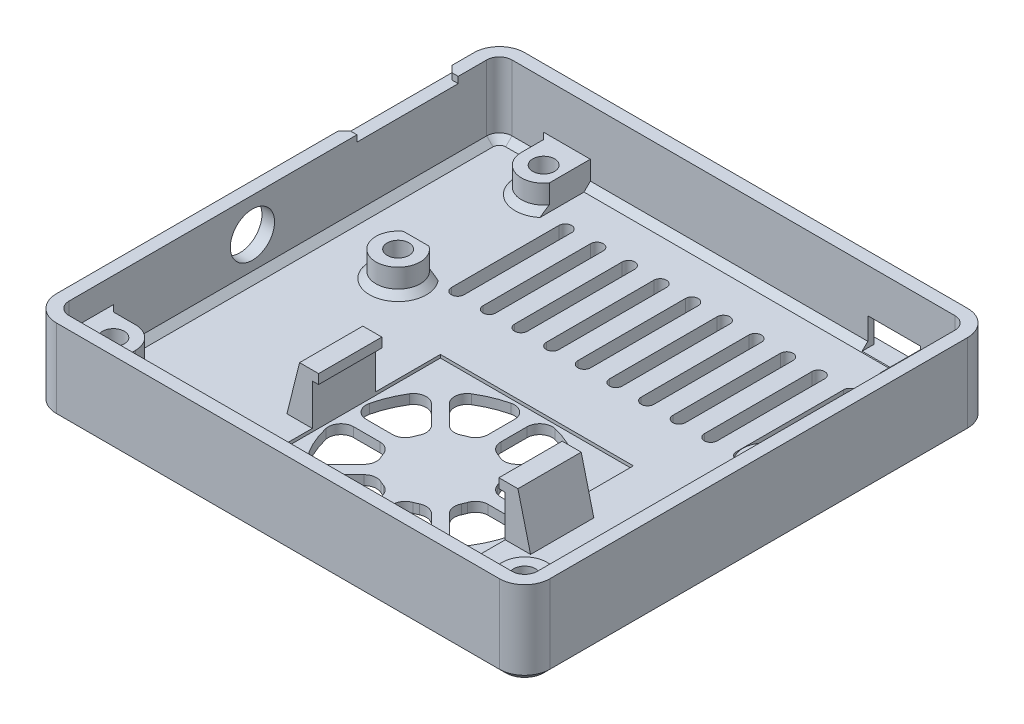
from build123d import *

# Parameters (mm, degrees)
BOSS_EXTRUDE1_DEPTH                               = 13.4
BOSS_EXTRUDE2_DEPTH                               = 2
BOSS_EXTRUDE3_DEPTH                               = 4
CSK_FOR_4_FLAT_HEAD_SOCKET_CAP_SCREW1_D           = 3.4544
CSK_FOR_4_FLAT_HEAD_SOCKET_CAP_SCREW1_CSINK_D     = 6.7237102
CSK_FOR_4_FLAT_HEAD_SOCKET_CAP_SCREW1_CSINK_ANGLE = 82
CUT_EXTRUDE1_REACH                                = 108.647
SKETCH7_W                                         = 8.3
SKETCH7_H                                         = 4.4
BOSS_EXTRUDE4_DEPTH                               = 7.4
CSK_FOR_4_FLAT_HEAD_SOCKET_CAP_SCREW2_D           = 3.4544
CSK_FOR_4_FLAT_HEAD_SOCKET_CAP_SCREW2_CSINK_D     = 6.7237102
CSK_FOR_4_FLAT_HEAD_SOCKET_CAP_SCREW2_CSINK_ANGLE = 82
CHAMFER1_SIZE                                     = 1
CHAMFER2_SIZE                                     = 1
CHAMFER3_SIZE                                     = 1
CHAMFER4_SIZE                                     = 1
CUT_EXTRUDE2_REACH                                = 97.86
SKETCH13_W                                        = 30.5
SKETCH13_H                                        = 30.5
CUT_EXTRUDE3_DEPTH                                = 0.5
SKETCH14_W                                        = 2
SKETCH14_H                                        = 10
BOSS_EXTRUDE5_DEPTH                               = 8
SKETCH15_W                                        = 10
SKETCH15_H                                        = 1.5
BOSS_EXTRUDE6_DEPTH                               = 1
SKETCH16_W                                        = 10
SKETCH16_H                                        = 1.5
BOSS_EXTRUDE7_DEPTH                               = 1
CHAMFER5_SIZE                                     = 2
CHAMFER5_SIZE_2                                   = 8.021561867
CUT_EXTRUDE4_DEPTH                                = 96.661387058
SKETCH18_R                                        = 3.5
CUT_EXTRUDE5_DEPTH                                = 97.161962556
CUT_EXTRUDE6_REACH                                = 99.75
SKETCH19_W                                        = 16
SKETCH19_H                                        = 1
CHAMFER6_SIZE                                     = 1


with BuildPart() as part:
    # Sketch2 → Boss-Extrude1 (new body)
    with BuildSketch(Plane(origin=(0, 0, 0), x_dir=(1, 0, 0), z_dir=(0, 1, 0))):
        with BuildLine():
            Line((-75.616981764, 12.627854819), (-75.616981764, -53.372145181))
            ThreePointArc((-75.616981764, -53.372145181), (-74.445408889, -56.200572306), (-71.616981764, -57.372145181))
            Line((-71.616981764, -57.372145181), (-1.616981764, -57.372145181))
            ThreePointArc((-1.616981764, -57.372145181), (1.211445361, -56.200572306), (2.383018236, -53.372145181))
            Line((2.383018236, -53.372145181), (2.383018236, 12.627854819))
            ThreePointArc((2.383018236, 12.627854819), (1.211445361, 15.456281944), (-1.616981764, 16.627854819))
            Line((-1.616981764, 16.627854819), (-71.616981764, 16.627854819))
            ThreePointArc((-71.616981764, 16.627854819), (-74.445408889, 15.456281944), (-75.616981764, 12.627854819))
        make_face()
        with BuildLine():
            Line((-73.616981764, 12.627854819), (-73.616981764, -53.372145181))
            ThreePointArc((-73.616981764, -53.372145181), (-73.031195326, -54.786358744), (-71.616981764, -55.372145181))
            Line((-71.616981764, -55.372145181), (-1.616981764, -55.372145181))
            ThreePointArc((-1.616981764, -55.372145181), (-0.202768202, -54.786358744), (0.383018236, -53.372145181))
            Line((0.383018236, -53.372145181), (0.383018236, 12.627854819))
            ThreePointArc((0.383018236, 12.627854819), (-0.202768202, 14.042068381), (-1.616981764, 14.627854819))
            Line((-1.616981764, 14.627854819), (-71.616981764, 14.627854819))
            ThreePointArc((-71.616981764, 14.627854819), (-73.031195326, 14.042068381), (-73.616981764, 12.627854819))
        make_face(mode=Mode.SUBTRACT)
    extrude(amount=BOSS_EXTRUDE1_DEPTH)

    # Sketch2<3> → Boss-Extrude2 (add)
    with BuildSketch(Plane(origin=(0, 0, 0), x_dir=(1, 0, 0), z_dir=(0, 1, 0))):
        with BuildLine():
            Line((-71.616981764, 14.627854819), (-1.616981764, 14.627854819))
            ThreePointArc((-1.616981764, 14.627854819), (-0.202768202, 14.042068381), (0.383018236, 12.627854819))
            Line((0.383018236, 12.627854819), (0.383018236, -53.372145181))
            ThreePointArc((0.383018236, -53.372145181), (-0.202768202, -54.786358744), (-1.616981764, -55.372145181))
            Line((-1.616981764, -55.372145181), (-71.616981764, -55.372145181))
            ThreePointArc((-71.616981764, -55.372145181), (-73.031195326, -54.786358744), (-73.616981764, -53.372145181))
            Line((-73.616981764, -53.372145181), (-73.616981764, 12.627854819))
            ThreePointArc((-73.616981764, 12.627854819), (-73.031195326, 14.042068381), (-71.616981764, 14.627854819))
        make_face()
    extrude(amount=BOSS_EXTRUDE2_DEPTH)

    # Sketch4 → Boss-Extrude3 (add)
    with BuildSketch(Plane(origin=(0, 2, 0), x_dir=(1, 0, 0), z_dir=(0, 1, 0))):
        with BuildLine():
            Line((-59.234341769, 14.627854819), (-59.234341769, 8.142814098))
            ThreePointArc((-59.234341769, 8.142814098), (-63.156395065, 6.785756677), (-65.616981764, 10.127854819))
            Line((-65.616981764, 10.127854819), (-65.616981764, 14.627854819))
            Line((-65.616981764, 14.627854819), (-59.234341769, 14.627854819))
        make_face()
        with BuildLine():
            Line((-4.116981764, 6.627854819), (0.383018236, 6.627854819))
            Line((0.383018236, 6.627854819), (0.383018236, 12.627854819))
            ThreePointArc((0.383018236, 12.627854819), (-0.202768202, 14.042068381), (-1.616981764, 14.627854819))
            Line((-1.616981764, 14.627854819), (-7.082532008, 14.627854819))
            Line((-7.082532008, 14.627854819), (-7.082532008, 8.268954136))
            ThreePointArc((-7.082532008, 8.268954136), (-5.811656897, 7.065490341), (-4.116981764, 6.627854819))
        make_face()
        with BuildLine():
            Line((-4.116981764, -9.372145181), (0.383018236, -9.372145181))
            Line((0.383018236, -9.372145181), (0.383018236, -16.372145181))
            Line((0.383018236, -16.372145181), (-4.116981764, -16.372145181))
            ThreePointArc((-4.116981764, -16.372145181), (-7.616981764, -12.872145181), (-4.116981764, -9.372145181))
        make_face()
        with BuildLine():
            Line((-64.139653984, -10.015784368), (-60.094309544, -10.015784368))
            ThreePointArc((-60.094309544, -10.015784368), (-62.116981764, -16.372145181), (-64.139653984, -10.015784368))
        make_face()
    extrude(amount=BOSS_EXTRUDE3_DEPTH)

    # CSK for #4 Flat Head Socket Cap Screw1 (through all)
    with Locations(Plane(origin=(0, 0, 0), x_dir=(-1, 0, 0), z_dir=(0, -1, 0))):
        with Locations((4.116981764, 10.127854819), (62.116981764, 10.127854819), (4.116981764, -12.872145181), (62.116981764, -12.872145181)):
            CounterSinkHole(CSK_FOR_4_FLAT_HEAD_SOCKET_CAP_SCREW1_D / 2, CSK_FOR_4_FLAT_HEAD_SOCKET_CAP_SCREW1_CSINK_D / 2, counter_sink_angle=CSK_FOR_4_FLAT_HEAD_SOCKET_CAP_SCREW1_CSINK_ANGLE)

    # Sketch7 → Cut-Extrude1 (cut, up to next)
    with BuildSketch(Plane(origin=(0, 0, -16.627854819), x_dir=(-1, 0, 0), z_dir=(0, 0, -1)), mode=Mode.PRIVATE) as cut_extrude1_sk1:
        with Locations((11.232532008, 4.3)):
            Rectangle(SKETCH7_W, SKETCH7_H)
    cut_extrude1_tool1 = extrude(cut_extrude1_sk1.sketch, amount=-CUT_EXTRUDE1_REACH, mode=Mode.PRIVATE) & part.part
    add(cut_extrude1_tool1.solids().sort_by_distance((-11.232532, 4.3, -16.627855))[0], mode=Mode.SUBTRACT)

    # Sketch9 → Boss-Extrude4 (add)
    with BuildSketch(Plane(origin=(0, 2, 0), x_dir=(1, 0, 0), z_dir=(0, 1, 0))):
        with BuildLine():
            Line((-69.116981764, -47.372145181), (-73.616981764, -47.372145181))
            Line((-73.616981764, -47.372145181), (-73.616981764, -53.372145181))
            ThreePointArc((-73.616981764, -53.372145181), (-73.031195326, -54.786358744), (-71.616981764, -55.372145181))
            Line((-71.616981764, -55.372145181), (-65.616981764, -55.372145181))
            Line((-65.616981764, -55.372145181), (-65.616981764, -50.872145181))
            ThreePointArc((-65.616981764, -50.872145181), (-66.64210803, -48.397271447), (-69.116981764, -47.372145181))
        make_face()
        with BuildLine():
            Line((-4.116981764, -47.372145181), (0.383018236, -47.372145181))
            Line((0.383018236, -47.372145181), (0.383018236, -53.372145181))
            ThreePointArc((0.383018236, -53.372145181), (-0.202768202, -54.786358744), (-1.616981764, -55.372145181))
            Line((-1.616981764, -55.372145181), (-7.616981764, -55.372145181))
            Line((-7.616981764, -55.372145181), (-7.616981764, -50.872145181))
            ThreePointArc((-7.616981764, -50.872145181), (-6.591855498, -48.397271447), (-4.116981764, -47.372145181))
        make_face()
    extrude(amount=BOSS_EXTRUDE4_DEPTH)

    # CSK for #4 Flat Head Socket Cap Screw2 (through all)
    with Locations(Plane(origin=(0, 0, 0), x_dir=(-1, 0, 0), z_dir=(0, -1, 0))):
        with Locations((4.116981764, -50.872145181), (69.116981764, -50.872145181)):
            CounterSinkHole(CSK_FOR_4_FLAT_HEAD_SOCKET_CAP_SCREW2_D / 2, CSK_FOR_4_FLAT_HEAD_SOCKET_CAP_SCREW2_CSINK_D / 2, counter_sink_angle=CSK_FOR_4_FLAT_HEAD_SOCKET_CAP_SCREW2_CSINK_ANGLE)

    # Chamfer1
    chamfer1_edges = [part.edges().sort_by_distance(p)[0] for p in [
        (0.383018236, 4, -6.627854819),
        (-65.616981764, 4, -14.627854819),
        (0.383018236, 5.7, 47.372145181),
        (-7.616981764, 5.7, 55.372145181),
        (-73.616981764, 5.7, 47.372145181),
        (-65.616981764, 5.7, 55.372145181),
        (0.383018236, 4, 16.372145181),
        (0.383018236, 4, 9.372145181),
    ]]
    chamfer(chamfer1_edges, length=CHAMFER1_SIZE)

    # Chamfer2
    # the kernel refuses this chamfer: 1 mm, written as the material it adds along each edge
    with BuildSketch(Plane(origin=(-62.116981764, 2, 12.872145181), x_dir=(0.003141587485879022, 0, -0.9999950652018582), z_dir=(-0.9999950652018582, 0, -0.003141587485879022))) as chamfer2_piece_1_section:
        Polygon((3.5, -CHAMFER2_SIZE), (3.5 + CHAMFER2_SIZE, 0), (3.5, 0), align=None)
    chamfer2_piece_1 = revolve(axis=Axis((-62.116981764, 2, 12.872145181), (0, -1, 0)), revolution_arc=359.64, mode=Mode.PRIVATE)
    chamfer2_piece_1 = split(chamfer2_piece_1, bisect_by=Plane(origin=(-62.116981764, 2.485154512, 10.015784368), z_dir=(0, 0, 1)), keep=Keep.TOP, mode=Mode.PRIVATE)
    add(chamfer2_piece_1)
    with BuildSketch(Plane(origin=(-65.616981764, 2, -10.127854819), x_dir=(0.02749587661058217, 0.9996219169112968, 0), z_dir=(0, 0, -1)), Plane(origin=(-4.116981764, 2, 9.372145181), x_dir=(0, 0.9996219169112968, 0.027495876610585623), z_dir=(1, 0, 0)), Plane(origin=(1.954701224, 2, 16.372145181), x_dir=(0, 0.9996219169112968, -0.027495876610585623), z_dir=(-1, 0, 0)), Plane(origin=(-4.116981764, 2, 47.372145181), x_dir=(0, 0.9996219169112968, 0.027495876610589075), z_dir=(1, 0, 0)), Plane(origin=(-7.616981764, 2, 56.943828169), x_dir=(0.027495876610586487, 0.9996219169112968, 0), z_dir=(0, 0, -1))) as chamfer2_piece_2:
        Polygon((CHAMFER2_SIZE * 0.999621916911, -CHAMFER2_SIZE * 0.0274958766106), (-CHAMFER2_SIZE * 0.0274958766106, -CHAMFER2_SIZE * 0.999621916911), (0, 0), align=None)
    extrude(amount=6.071682988)
    with BuildSketch(Plane(origin=(-62.116981764, 2, -10.127854819), x_dir=(0.991235900196607, 0, -0.13210370987001793), z_dir=(-0.13210370987001793, 0, -0.991235900196607))) as chamfer2_piece_3_section:
        Polygon((3.5, -CHAMFER2_SIZE), (3.5 + CHAMFER2_SIZE, 0), (3.5, 0), align=None)
    chamfer2_piece_3 = revolve(axis=Axis((-62.116981764, 2, -10.127854819), (0, -1, 0)), revolution_arc=187.591174622, mode=Mode.PRIVATE)
    chamfer2_piece_3 = split(chamfer2_piece_3, bisect_by=Plane(origin=(-59.234341769, 2.488876312, -6.31893593), z_dir=(-1, 0, 0)), keep=Keep.TOP, mode=Mode.PRIVATE)
    add(chamfer2_piece_3)
    with BuildSketch(Plane(origin=(-4.116981764, 2, -6.627854819), x_dir=(0, 0.9996219169112968, -0.027495876610586487), z_dir=(1, 0, 0)), Plane(origin=(-65.616981764, 2, 56.943828169), x_dir=(-0.02749587661058217, 0.9996219169112968, 0), z_dir=(0, 0, -1)), Plane(origin=(-69.116981764, 2, 47.372145181), x_dir=(0, 0.9996219169112968, 0.027495876610589075), z_dir=(-1, 0, 0))) as chamfer2_piece_4:
        Polygon((CHAMFER2_SIZE * 0.999621916911, CHAMFER2_SIZE * 0.0274958766106), (-CHAMFER2_SIZE * 0.0274958766106, CHAMFER2_SIZE * 0.999621916911), (0, 0), align=None)
    extrude(amount=6.071682988)
    with BuildSketch(Plane(origin=(-4.116981764, 2, -10.127854819), x_dir=(-0.984731163899138, 0, -0.17408197737229716), z_dir=(0.17408197737229716, 0, -0.984731163899138))) as chamfer2_piece_5_section:
        Polygon((3.5, CHAMFER2_SIZE), (3.5 + CHAMFER2_SIZE, 0), (3.5, 0), align=None)
    chamfer2_piece_5 = revolve(axis=Axis((-4.116981764, 2, -10.127854819), (0, 1, 0)), revolution_arc=100.0252393, mode=Mode.PRIVATE)
    chamfer2_piece_5 = split(chamfer2_piece_5, bisect_by=Plane(origin=(-7.082532008, 2.379155604, -7.145485846), z_dir=(1, 0, 0)), keep=Keep.TOP, mode=Mode.PRIVATE)
    add(chamfer2_piece_5)
    with BuildSketch(Plane(origin=(0.383018236, 2, -8.199537807), x_dir=(0.02749587661058643, 0.9996219169112968, 0), z_dir=(0, 0, 1))) as chamfer2_piece_6:
        Polygon((CHAMFER2_SIZE * 0.999621916911, CHAMFER2_SIZE * 0.0274958766106), (-CHAMFER2_SIZE * 0.0274958766106, CHAMFER2_SIZE * 0.999621916911), (0, 0), align=None)
    extrude(amount=19.143365976)
    with BuildSketch(Plane(origin=(-4.116981764, 2, 12.872145181), x_dir=(0, 0, 1), z_dir=(1, 0, 0))) as chamfer2_piece_7:
        Polygon((3.5, -CHAMFER2_SIZE), (3.5 + CHAMFER2_SIZE, 0), (3.5, 0), align=None)
    revolve(axis=Axis((-4.116981764, 2, 12.872145181), (0, -1, 0)), revolution_arc=180)
    with BuildSketch(Plane(origin=(0.383018236, 2, 14.800462193), x_dir=(0.02749587661058638, 0.9996219169112968, 0), z_dir=(0, 0, 1))) as chamfer2_piece_8:
        Polygon((CHAMFER2_SIZE * 0.999621916911, CHAMFER2_SIZE * 0.0274958766106), (-CHAMFER2_SIZE * 0.0274958766106, CHAMFER2_SIZE * 0.999621916911), (0, 0), align=None)
    extrude(amount=34.143365976)
    with BuildSketch(Plane(origin=(-4.116981764, 2, 50.872145181), x_dir=(-1, 0, 0), z_dir=(0, 0, 1))) as chamfer2_piece_9:
        Polygon((3.5, -CHAMFER2_SIZE), (3.5 + CHAMFER2_SIZE, 0), (3.5, 0), align=None)
    revolve(axis=Axis((-4.116981764, 2, 50.872145181), (0, -1, 0)), revolution_arc=90)
    with BuildSketch(Plane(origin=(-6.045298776, 2, 55.372145181), x_dir=(0, 0.9996219169112968, 0.027495876610589075), z_dir=(-1, 0, 0))) as chamfer2_piece_10:
        Polygon((CHAMFER2_SIZE * 0.999621916911, CHAMFER2_SIZE * 0.0274958766106), (-CHAMFER2_SIZE * 0.0274958766106, CHAMFER2_SIZE * 0.999621916911), (0, 0), align=None)
    extrude(amount=61.143365976)
    with BuildSketch(Plane(origin=(-69.116981764, 2, 50.872145181), x_dir=(1, 0, 0), z_dir=(0, 0, 1))) as chamfer2_piece_11:
        Polygon((3.5, CHAMFER2_SIZE), (3.5 + CHAMFER2_SIZE, 0), (3.5, 0), align=None)
    revolve(axis=Axis((-69.116981764, 2, 50.872145181), (0, 1, 0)), revolution_arc=90)
    with BuildSketch(Plane(origin=(-71.616981764, 2, -14.627854819), x_dir=(0, 0.9996219169112968, -0.027495876610585623), z_dir=(1, 0, 0))) as chamfer2_piece_12:
        Polygon((CHAMFER2_SIZE * 0.999621916911, CHAMFER2_SIZE * 0.0274958766106), (-CHAMFER2_SIZE * 0.0274958766106, CHAMFER2_SIZE * 0.999621916911), (0, 0), align=None)
    extrude(amount=7.571682988)
    with BuildSketch(Plane(origin=(-71.616981764, 2, -12.627854819), x_dir=(-1, 0, 0), z_dir=(0, 0, 1))) as chamfer2_piece_13:
        Polygon((2, -CHAMFER2_SIZE), (2 - CHAMFER2_SIZE, 0), (2, 0), align=None)
    revolve(axis=Axis((-71.616981764, 2, -12.627854819), (0, -1, 0)), revolution_arc=90)
    with BuildSketch(Plane(origin=(-73.616981764, 2, 48.943828169), x_dir=(-0.02749587661058217, 0.9996219169112968, 0), z_dir=(0, 0, -1))) as chamfer2_piece_14:
        Polygon((CHAMFER2_SIZE * 0.999621916911, CHAMFER2_SIZE * 0.0274958766106), (-CHAMFER2_SIZE * 0.0274958766106, CHAMFER2_SIZE * 0.999621916911), (0, 0), align=None)
    extrude(amount=61.571682988)
    with BuildSketch(Plane(origin=(-61.806024757, 2, -14.627854819), x_dir=(0, 0.9996219169112968, -0.027495876610585623), z_dir=(1, 0, 0))) as chamfer2_piece_15_section:
        Polygon((CHAMFER2_SIZE * 0.999621916911, CHAMFER2_SIZE * 0.0274958766106), (-CHAMFER2_SIZE * 0.0274958766106, CHAMFER2_SIZE * 0.999621916911), (0, 0), align=None)
    chamfer2_piece_15 = extrude(amount=57.295175737, mode=Mode.PRIVATE)
    chamfer2_piece_15 = split(chamfer2_piece_15, bisect_by=Plane(origin=(-15.382532008, 2.4, -14.327854819), z_dir=(-1, 0, 0)), keep=Keep.TOP, mode=Mode.PRIVATE)
    add(chamfer2_piece_15)
    with BuildSketch(Plane(origin=(-61.806024757, 2, -14.627854819), x_dir=(0, 0.9996219169112968, -0.027495876610585623), z_dir=(1, 0, 0))) as chamfer2_piece_16_section:
        Polygon((CHAMFER2_SIZE * 0.999621916911, CHAMFER2_SIZE * 0.0274958766106), (-CHAMFER2_SIZE * 0.0274958766106, CHAMFER2_SIZE * 0.999621916911), (0, 0), align=None)
    chamfer2_piece_16 = extrude(amount=57.295175737, mode=Mode.PRIVATE)
    chamfer2_piece_16 = split(chamfer2_piece_16, bisect_by=Plane(origin=(-11.232532008, 2.1, -14.152416222), z_dir=(0, -1, 0)), keep=Keep.TOP, mode=Mode.PRIVATE)
    add(chamfer2_piece_16)

    # Chamfer3
    chamfer3_edges = [part.edges().sort_by_distance(p)[0] for p in [
        (-75.616981764, 0, 20.372145181),
        (-74.445408889, 0, -15.456281944),
        (-36.616981764, 0, -16.627854819),
        (1.211445361, 0, -15.456281944),
        (2.383018236, 0, 20.372145181),
        (1.211445361, 0, 56.200572306),
        (-36.616981764, 0, 57.372145181),
        (-74.445408889, 0, 56.200572306),
    ]]
    chamfer(chamfer3_edges, length=CHAMFER3_SIZE)

    # Chamfer4
    chamfer4_edges = [part.edges().sort_by_distance(p)[0] for p in [
        (-7.082532008, 4.3, -16.627854819),
        (-15.382532008, 4.3, -16.627854819),
    ]]
    chamfer(chamfer4_edges, length=CHAMFER4_SIZE)

    # Sketch12 → Cut-Extrude2 (cut, up to next)
    with BuildSketch(Plane.XZ, mode=Mode.PRIVATE) as cut_extrude2_sk1:
        with BuildLine():
            Line((-54.660539895, 9.911346827), (-54.660539895, -7.088653173))
            ThreePointArc((-54.660539895, -7.088653173), (-55.660539895, -8.088653173), (-56.660539895, -7.088653173))
            Line((-56.660539895, -7.088653173), (-56.660539895, 9.911346827))
            ThreePointArc((-56.660539895, 9.911346827), (-55.660539895, 10.911346827), (-54.660539895, 9.911346827))
        make_face()
    cut_extrude2_tool1 = extrude(cut_extrude2_sk1.sketch, amount=-CUT_EXTRUDE2_REACH, mode=Mode.PRIVATE) & part.part
    # Sketch12 → Cut-Extrude2 (cut, up to next)
    with BuildSketch(Plane.XZ, mode=Mode.PRIVATE) as cut_extrude2_sk2:
        with BuildLine():
            Line((-49.660539895, 9.911346827), (-49.660539895, -7.088653173))
            ThreePointArc((-49.660539895, -7.088653173), (-50.660539895, -8.088653173), (-51.660539895, -7.088653173))
            Line((-51.660539895, -7.088653173), (-51.660539895, 9.911346827))
            ThreePointArc((-51.660539895, 9.911346827), (-50.660539895, 10.911346827), (-49.660539895, 9.911346827))
        make_face()
    cut_extrude2_tool2 = extrude(cut_extrude2_sk2.sketch, amount=-CUT_EXTRUDE2_REACH, mode=Mode.PRIVATE) & part.part
    # Sketch12 → Cut-Extrude2 (cut, up to next)
    with BuildSketch(Plane.XZ, mode=Mode.PRIVATE) as cut_extrude2_sk3:
        with BuildLine():
            Line((-44.660539895, 9.911346827), (-44.660539895, -7.088653173))
            ThreePointArc((-44.660539895, -7.088653173), (-45.660539895, -8.088653173), (-46.660539895, -7.088653173))
            Line((-46.660539895, -7.088653173), (-46.660539895, 9.911346827))
            ThreePointArc((-46.660539895, 9.911346827), (-45.660539895, 10.911346827), (-44.660539895, 9.911346827))
        make_face()
    cut_extrude2_tool3 = extrude(cut_extrude2_sk3.sketch, amount=-CUT_EXTRUDE2_REACH, mode=Mode.PRIVATE) & part.part
    # Sketch12 → Cut-Extrude2 (cut, up to next)
    with BuildSketch(Plane.XZ, mode=Mode.PRIVATE) as cut_extrude2_sk4:
        with BuildLine():
            Line((-39.660539895, 9.911346827), (-39.660539895, -7.088653173))
            ThreePointArc((-39.660539895, -7.088653173), (-40.660539895, -8.088653173), (-41.660539895, -7.088653173))
            Line((-41.660539895, -7.088653173), (-41.660539895, 9.911346827))
            ThreePointArc((-41.660539895, 9.911346827), (-40.660539895, 10.911346827), (-39.660539895, 9.911346827))
        make_face()
    cut_extrude2_tool4 = extrude(cut_extrude2_sk4.sketch, amount=-CUT_EXTRUDE2_REACH, mode=Mode.PRIVATE) & part.part
    # Sketch12 → Cut-Extrude2 (cut, up to next)
    with BuildSketch(Plane.XZ, mode=Mode.PRIVATE) as cut_extrude2_sk5:
        with BuildLine():
            Line((-34.660539895, 9.911346827), (-34.660539895, -7.088653173))
            ThreePointArc((-34.660539895, -7.088653173), (-35.660539895, -8.088653173), (-36.660539895, -7.088653173))
            Line((-36.660539895, -7.088653173), (-36.660539895, 9.911346827))
            ThreePointArc((-36.660539895, 9.911346827), (-35.660539895, 10.911346827), (-34.660539895, 9.911346827))
        make_face()
    cut_extrude2_tool5 = extrude(cut_extrude2_sk5.sketch, amount=-CUT_EXTRUDE2_REACH, mode=Mode.PRIVATE) & part.part
    # Sketch12 → Cut-Extrude2 (cut, up to next)
    with BuildSketch(Plane.XZ, mode=Mode.PRIVATE) as cut_extrude2_sk6:
        with BuildLine():
            Line((-29.660539895, 9.911346827), (-29.660539895, -7.088653173))
            ThreePointArc((-29.660539895, -7.088653173), (-30.660539895, -8.088653173), (-31.660539895, -7.088653173))
            Line((-31.660539895, -7.088653173), (-31.660539895, 9.911346827))
            ThreePointArc((-31.660539895, 9.911346827), (-30.660539895, 10.911346827), (-29.660539895, 9.911346827))
        make_face()
    cut_extrude2_tool6 = extrude(cut_extrude2_sk6.sketch, amount=-CUT_EXTRUDE2_REACH, mode=Mode.PRIVATE) & part.part
    # Sketch12 → Cut-Extrude2 (cut, up to next)
    with BuildSketch(Plane.XZ, mode=Mode.PRIVATE) as cut_extrude2_sk7:
        with BuildLine():
            Line((-24.660539895, 9.911346827), (-24.660539895, -7.088653173))
            ThreePointArc((-24.660539895, -7.088653173), (-25.660539895, -8.088653173), (-26.660539895, -7.088653173))
            Line((-26.660539895, -7.088653173), (-26.660539895, 9.911346827))
            ThreePointArc((-26.660539895, 9.911346827), (-25.660539895, 10.911346827), (-24.660539895, 9.911346827))
        make_face()
    cut_extrude2_tool7 = extrude(cut_extrude2_sk7.sketch, amount=-CUT_EXTRUDE2_REACH, mode=Mode.PRIVATE) & part.part
    # Sketch12 → Cut-Extrude2 (cut, up to next)
    with BuildSketch(Plane.XZ, mode=Mode.PRIVATE) as cut_extrude2_sk8:
        with BuildLine():
            Line((-19.660539895, 9.911346827), (-19.660539895, -7.088653173))
            ThreePointArc((-19.660539895, -7.088653173), (-20.660539895, -8.088653173), (-21.660539895, -7.088653173))
            Line((-21.660539895, -7.088653173), (-21.660539895, 9.911346827))
            ThreePointArc((-21.660539895, 9.911346827), (-20.660539895, 10.911346827), (-19.660539895, 9.911346827))
        make_face()
    cut_extrude2_tool8 = extrude(cut_extrude2_sk8.sketch, amount=-CUT_EXTRUDE2_REACH, mode=Mode.PRIVATE) & part.part
    # Sketch12 → Cut-Extrude2 (cut, up to next)
    with BuildSketch(Plane.XZ, mode=Mode.PRIVATE) as cut_extrude2_sk9:
        with BuildLine():
            Line((-14.660539895, 9.911346827), (-14.660539895, -7.088653173))
            ThreePointArc((-14.660539895, -7.088653173), (-15.660539895, -8.088653173), (-16.660539895, -7.088653173))
            Line((-16.660539895, -7.088653173), (-16.660539895, 9.911346827))
            ThreePointArc((-16.660539895, 9.911346827), (-15.660539895, 10.911346827), (-14.660539895, 9.911346827))
        make_face()
    cut_extrude2_tool9 = extrude(cut_extrude2_sk9.sketch, amount=-CUT_EXTRUDE2_REACH, mode=Mode.PRIVATE) & part.part
    # Sketch12 → Cut-Extrude2 (cut, up to next)
    with BuildSketch(Plane.XZ, mode=Mode.PRIVATE) as cut_extrude2_sk10:
        with BuildLine():
            Line((-9.660539895, 9.911346827), (-9.660539895, -7.088653173))
            ThreePointArc((-9.660539895, -7.088653173), (-10.660539895, -8.088653173), (-11.660539895, -7.088653173))
            Line((-11.660539895, -7.088653173), (-11.660539895, 9.911346827))
            ThreePointArc((-11.660539895, 9.911346827), (-10.660539895, 10.911346827), (-9.660539895, 9.911346827))
        make_face()
    cut_extrude2_tool10 = extrude(cut_extrude2_sk10.sketch, amount=-CUT_EXTRUDE2_REACH, mode=Mode.PRIVATE) & part.part
    add(cut_extrude2_tool1.solids().sort_by_distance((-55.66054, 0, 1.411347))[0], mode=Mode.SUBTRACT)
    add(cut_extrude2_tool2.solids().sort_by_distance((-50.66054, 0, 1.411347))[0], mode=Mode.SUBTRACT)
    add(cut_extrude2_tool3.solids().sort_by_distance((-45.66054, 0, 1.411347))[0], mode=Mode.SUBTRACT)
    add(cut_extrude2_tool4.solids().sort_by_distance((-40.66054, 0, 1.411347))[0], mode=Mode.SUBTRACT)
    add(cut_extrude2_tool5.solids().sort_by_distance((-35.66054, 0, 1.411347))[0], mode=Mode.SUBTRACT)
    add(cut_extrude2_tool6.solids().sort_by_distance((-30.66054, 0, 1.411347))[0], mode=Mode.SUBTRACT)
    add(cut_extrude2_tool7.solids().sort_by_distance((-25.66054, 0, 1.411347))[0], mode=Mode.SUBTRACT)
    add(cut_extrude2_tool8.solids().sort_by_distance((-20.66054, 0, 1.411347))[0], mode=Mode.SUBTRACT)
    add(cut_extrude2_tool9.solids().sort_by_distance((-15.66054, 0, 1.411347))[0], mode=Mode.SUBTRACT)
    add(cut_extrude2_tool10.solids().sort_by_distance((-10.66054, 0, 1.411347))[0], mode=Mode.SUBTRACT)

    # Sketch13 → Cut-Extrude3 (cut)
    with BuildSketch(Plane(origin=(0, 2, 0), x_dir=(1, 0, 0), z_dir=(0, 1, 0))):
        with Locations((-33.116981764, -35.190207042)):
            Rectangle(SKETCH13_W, SKETCH13_H)
    extrude(amount=-CUT_EXTRUDE3_DEPTH, mode=Mode.SUBTRACT)

    # Sketch14 → Boss-Extrude5 (add)
    with BuildSketch(Plane(origin=(0, 2, 0), x_dir=(1, 0, 0), z_dir=(0, 1, 0))):
        with Locations((-49.366981764, -35.190207042)):
            Rectangle(SKETCH14_W, SKETCH14_H)
        with Locations((-16.866981764, -35.190207042)):
            Rectangle(SKETCH14_W, SKETCH14_H)
    extrude(amount=BOSS_EXTRUDE5_DEPTH)

    # Sketch15 → Boss-Extrude6 (add)
    with BuildSketch(Plane.ZY.offset(17.866981764)):
        with Locations((35.190207042, 9.25)):
            Rectangle(SKETCH15_W, SKETCH15_H)
    extrude(amount=BOSS_EXTRUDE6_DEPTH)

    # Sketch16 → Boss-Extrude7 (add)
    with BuildSketch(Plane(origin=(-48.366981764, 0, 0), x_dir=(0, 0, -1), z_dir=(1, 0, 0))):
        with Locations((-35.190207042, 9.25)):
            Rectangle(SKETCH16_W, SKETCH16_H)
    extrude(amount=BOSS_EXTRUDE7_DEPTH)

    # Chamfer5
    # the kernel refuses this chamfer: 8.021561867, 2 mm, written as the material it adds along each edge
    with BuildSketch(Plane(origin=(-50.366981764, 2, 40.190207042), x_dir=(-0.9889581332499592, -0.14819517765013834, 0), z_dir=(0, 0, -1))) as chamfer5_piece_1_section:
        Polygon((CHAMFER5_SIZE * 0.98895813325, CHAMFER5_SIZE * 0.14819517765), (-CHAMFER5_SIZE_2 * 0.148195177651, CHAMFER5_SIZE_2 * 0.988958133259), (0, 0), align=None)
    chamfer5_piece_1 = extrude(amount=10, mode=Mode.PRIVATE)
    chamfer5_piece_1 = split(chamfer5_piece_1, bisect_by=Plane(origin=(-51.896020518, 10, 35.190207042), z_dir=(0, -1, 0)), keep=Keep.TOP, mode=Mode.PRIVATE)
    add(chamfer5_piece_1)
    with BuildSketch(Plane(origin=(-15.866981764, 2, 30.190207042), x_dir=(0.9889581332499592, -0.14819517765013798, 0), z_dir=(0, 0, 1))) as chamfer5_piece_2_section:
        Polygon((CHAMFER5_SIZE * 0.98895813325, CHAMFER5_SIZE * 0.14819517765), (-CHAMFER5_SIZE_2 * 0.148195177651, CHAMFER5_SIZE_2 * 0.988958133259), (0, 0), align=None)
    chamfer5_piece_2 = extrude(amount=10, mode=Mode.PRIVATE)
    chamfer5_piece_2 = split(chamfer5_piece_2, bisect_by=Plane(origin=(-14.396020518, 10, 35.190207042), z_dir=(0, -1, 0)), keep=Keep.TOP, mode=Mode.PRIVATE)
    add(chamfer5_piece_2)

    # Sketch17 → Cut-Extrude4 (cut, through all)
    with BuildSketch(Plane(origin=(0, 1.5, 0), x_dir=(1, 0, 0), z_dir=(0, 1, 0))):
        with BuildLine():
            Line((-41.396104278, -25.496870966), (-38.453164464, -28.43981078))
            ThreePointArc((-38.453164464, -28.43981078), (-37.374934115, -28.997174069), (-36.172958249, -28.828388588))
            ThreePointArc((-36.172958249, -28.828388588), (-35.817862811, -28.669703389), (-35.454565038, -28.530820377))
            ThreePointArc((-35.454565038, -28.530820377), (-34.485290394, -27.800244449), (-34.116981764, -26.643705097))
            Line((-34.116981764, -26.643705097), (-34.116981764, -22.481759699))
            ThreePointArc((-34.116981764, -22.481759699), (-34.875811955, -20.913481183), (-36.576479269, -20.535259752))
            ThreePointArc((-36.576479269, -20.535259752), (-38.87933027, -21.278667129), (-41.033360226, -22.381360291))
            ThreePointArc((-41.033360226, -22.381360291), (-41.968470678, -23.851356619), (-41.396104278, -25.496870966))
        make_face()
        with BuildLine():
            Line((-32.116981764, -22.481759699), (-32.116981764, -26.643705097))
            ThreePointArc((-32.116981764, -26.643705097), (-31.748673134, -27.800244449), (-30.77939849, -28.530820377))
            ThreePointArc((-30.77939849, -28.530820377), (-30.416100717, -28.669703389), (-30.061005279, -28.828388588))
            ThreePointArc((-30.061005279, -28.828388588), (-28.859029413, -28.997174069), (-27.780799064, -28.43981078))
            Line((-27.780799064, -28.43981078), (-24.83785925, -25.496870966))
            ThreePointArc((-24.83785925, -25.496870966), (-24.26549285, -23.851356619), (-25.200603302, -22.381360291))
            ThreePointArc((-25.200603302, -22.381360291), (-27.354633258, -21.278667129), (-29.657484259, -20.535259752))
            ThreePointArc((-29.657484259, -20.535259752), (-31.358151573, -20.913481183), (-32.116981764, -22.481759699))
        make_face()
        with BuildLine():
            Line((-23.423645688, -26.911084529), (-26.366585501, -29.854024342))
            ThreePointArc((-26.366585501, -29.854024342), (-26.92394879, -30.932254691), (-26.75516331, -32.134230557))
            ThreePointArc((-26.75516331, -32.134230557), (-26.596478111, -32.489325996), (-26.457595098, -32.852623769))
            ThreePointArc((-26.457595098, -32.852623769), (-25.727019171, -33.821898412), (-24.570479818, -34.190207042))
            Line((-24.570479818, -34.190207042), (-20.408534421, -34.190207042))
            ThreePointArc((-20.408534421, -34.190207042), (-18.840255904, -33.431376852), (-18.462034474, -31.730709538))
            ThreePointArc((-18.462034474, -31.730709538), (-19.20544185, -29.427858537), (-20.308135012, -27.27382858))
            ThreePointArc((-20.308135012, -27.27382858), (-21.778131341, -26.338718129), (-23.423645688, -26.911084529))
        make_face()
        with BuildLine():
            Line((-20.408534421, -36.190207042), (-24.570479818, -36.190207042))
            ThreePointArc((-24.570479818, -36.190207042), (-25.727019171, -36.558515673), (-26.457595098, -37.527790316))
            ThreePointArc((-26.457595098, -37.527790316), (-26.596478111, -37.891088089), (-26.75516331, -38.246183528))
            ThreePointArc((-26.75516331, -38.246183528), (-26.92394879, -39.448159394), (-26.366585501, -40.526389743))
            Line((-26.366585501, -40.526389743), (-23.423645688, -43.469329556))
            ThreePointArc((-23.423645688, -43.469329556), (-21.778131341, -44.041695956), (-20.308135012, -43.106585505))
            ThreePointArc((-20.308135012, -43.106585505), (-19.20544185, -40.952555548), (-18.462034474, -38.649704547))
            ThreePointArc((-18.462034474, -38.649704547), (-18.840255904, -36.949037233), (-20.408534421, -36.190207042))
        make_face()
        with BuildLine():
            Line((-24.83785925, -44.883543119), (-27.780799064, -41.940603305))
            ThreePointArc((-27.780799064, -41.940603305), (-28.859029413, -41.383240016), (-30.061005279, -41.552025497))
            ThreePointArc((-30.061005279, -41.552025497), (-30.416100717, -41.710710696), (-30.77939849, -41.849593708))
            ThreePointArc((-30.77939849, -41.849593708), (-31.748673134, -42.580169636), (-32.116981764, -43.736708988))
            Line((-32.116981764, -43.736708988), (-32.116981764, -47.898654386))
            ThreePointArc((-32.116981764, -47.898654386), (-31.358151573, -49.466932902), (-29.657484259, -49.845154333))
            ThreePointArc((-29.657484259, -49.845154333), (-27.354633258, -49.101746956), (-25.200603302, -47.999053794))
            ThreePointArc((-25.200603302, -47.999053794), (-24.26549285, -46.529057466), (-24.83785925, -44.883543119))
        make_face()
        with BuildLine():
            Line((-34.116981764, -47.898654386), (-34.116981764, -43.736708988))
            ThreePointArc((-34.116981764, -43.736708988), (-34.485290394, -42.580169636), (-35.454565038, -41.849593708))
            ThreePointArc((-35.454565038, -41.849593708), (-35.817862811, -41.710710696), (-36.172958249, -41.552025497))
            ThreePointArc((-36.172958249, -41.552025497), (-37.374934115, -41.383240016), (-38.453164464, -41.940603305))
            Line((-38.453164464, -41.940603305), (-41.396104278, -44.883543119))
            ThreePointArc((-41.396104278, -44.883543119), (-41.968470678, -46.529057466), (-41.033360226, -47.999053794))
            ThreePointArc((-41.033360226, -47.999053794), (-38.87933027, -49.101746956), (-36.576479269, -49.845154333))
            ThreePointArc((-36.576479269, -49.845154333), (-34.875811955, -49.466932902), (-34.116981764, -47.898654386))
        make_face()
        with BuildLine():
            Line((-42.81031784, -43.469329556), (-39.867378027, -40.526389743))
            ThreePointArc((-39.867378027, -40.526389743), (-39.310014738, -39.448159394), (-39.478800218, -38.246183528))
            ThreePointArc((-39.478800218, -38.246183528), (-39.637485418, -37.891088089), (-39.77636843, -37.527790316))
            ThreePointArc((-39.77636843, -37.527790316), (-40.506944357, -36.558515673), (-41.66348371, -36.190207042))
            Line((-41.66348371, -36.190207042), (-45.825429108, -36.190207042))
            ThreePointArc((-45.825429108, -36.190207042), (-47.393707624, -36.949037233), (-47.771929054, -38.649704547))
            ThreePointArc((-47.771929054, -38.649704547), (-47.028521678, -40.952555548), (-45.925828516, -43.106585505))
            ThreePointArc((-45.925828516, -43.106585505), (-44.455832187, -44.041695956), (-42.81031784, -43.469329556))
        make_face()
        with BuildLine():
            Line((-45.825429108, -34.190207042), (-41.66348371, -34.190207042))
            ThreePointArc((-41.66348371, -34.190207042), (-40.506944357, -33.821898412), (-39.77636843, -32.852623769))
            ThreePointArc((-39.77636843, -32.852623769), (-39.637485418, -32.489325996), (-39.478800218, -32.134230557))
            ThreePointArc((-39.478800218, -32.134230557), (-39.310014738, -30.932254691), (-39.867378027, -29.854024342))
            Line((-39.867378027, -29.854024342), (-42.81031784, -26.911084529))
            ThreePointArc((-42.81031784, -26.911084529), (-44.455832187, -26.338718129), (-45.925828516, -27.27382858))
            ThreePointArc((-45.925828516, -27.27382858), (-47.028521678, -29.427858537), (-47.771929054, -31.730709538))
            ThreePointArc((-47.771929054, -31.730709538), (-47.393707624, -33.431376852), (-45.825429108, -34.190207042))
        make_face()
    extrude(amount=-CUT_EXTRUDE4_DEPTH, mode=Mode.SUBTRACT)

    # Sketch18 → Cut-Extrude5 (cut, through all)
    with BuildSketch(Plane(origin=(-73.616981764, 0, 0), x_dir=(0, 0, -1), z_dir=(1, 0, 0))):
        with Locations((-24.394093065, 7.999619581)):
            Circle(SKETCH18_R)
    extrude(amount=-CUT_EXTRUDE5_DEPTH, mode=Mode.SUBTRACT)

    # Sketch19 → Cut-Extrude6 (cut, up to next)
    with BuildSketch(Plane.ZY.offset(75.616981764), mode=Mode.PRIVATE) as cut_extrude6_sk1:
        with Locations((-0.127854819, 12.9)):
            Rectangle(SKETCH19_W, SKETCH19_H)
    cut_extrude6_tool1 = extrude(cut_extrude6_sk1.sketch, amount=-CUT_EXTRUDE6_REACH, mode=Mode.PRIVATE) & part.part
    add(cut_extrude6_tool1.solids().sort_by_distance((-75.616982, 12.9, -0.127855))[0], mode=Mode.SUBTRACT)

    # Chamfer6
    chamfer6_edges = [part.edges().sort_by_distance(p)[0] for p in [
        (-75.616981764, 12.9, -8.127854819),
        (-75.616981764, 12.9, 7.872145181),
    ]]
    chamfer(chamfer6_edges, length=CHAMFER6_SIZE)


solid = part.part
